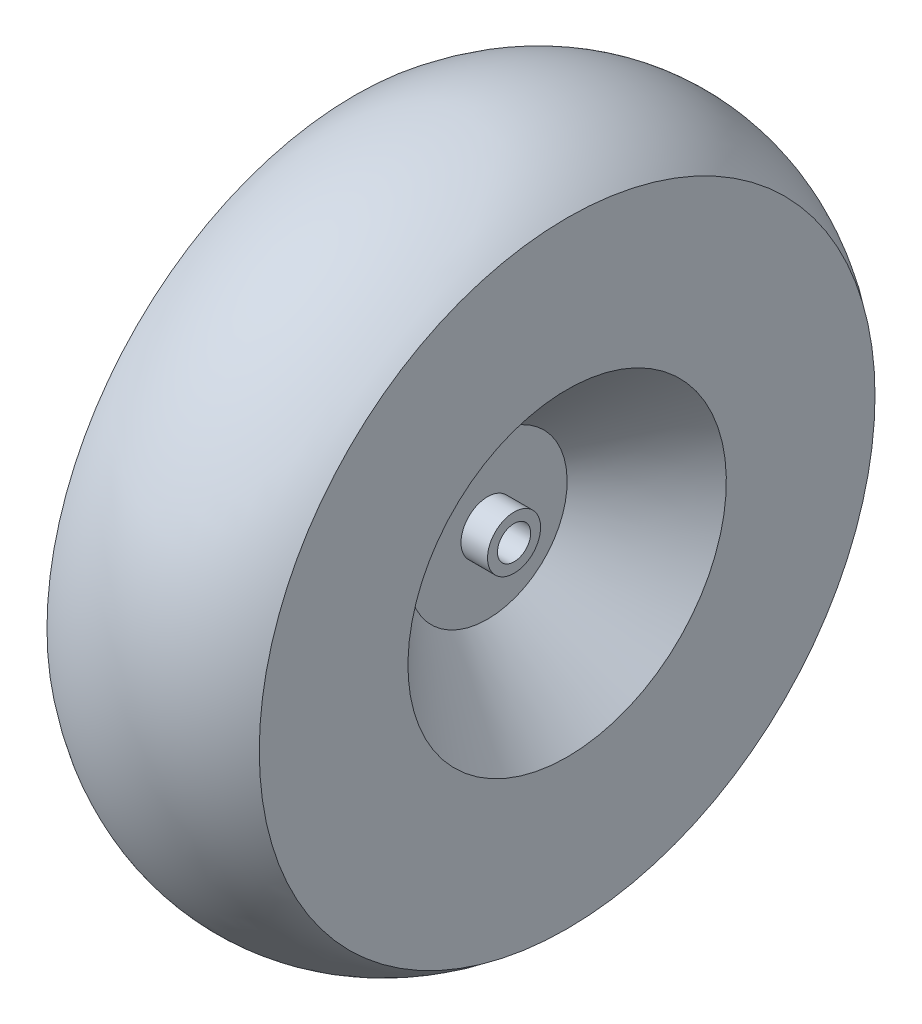
from build123d import *


with BuildPart() as part:
    # Sketch7 → Revolve6 (revolve)
    with BuildSketch(Plane.XY):
        with BuildLine():
            Line((-25.4, 7.9375), (25.4, 7.9375))
            Line((25.4, 7.9375), (25.4, 12.7))
            Line((25.4, 12.7), (12.7, 12.7))
            Line((12.7, 12.7), (12.7, 38.1))
            Line((12.7, 38.1), (50.8, 76.2))
            Line((50.8, 76.2), (50.8, 147.35865108))
            add(Edge.make_bspline(
                [(50.8, 147.35865108), (0, 187.484544424), (-50.8, 147.35865108)],
                knots=[2.485810722, 2.485810722, 2.485810722, 3.797374586, 3.797374586, 3.797374586], degree=2, weights=[1, 0.792571365, 1]))
            Line((-50.8, 147.35865108), (-50.8, 76.2))
            Line((-50.8, 76.2), (-12.7, 38.1))
            Line((-12.7, 38.1), (-12.7, 12.7))
            Line((-12.7, 12.7), (-25.4, 12.7))
            Line((-25.4, 12.7), (-25.4, 7.9375))
        make_face()
    revolve(axis=Axis((-25.4, 0, 0), (1, 0, 0)))


solid = part.part
